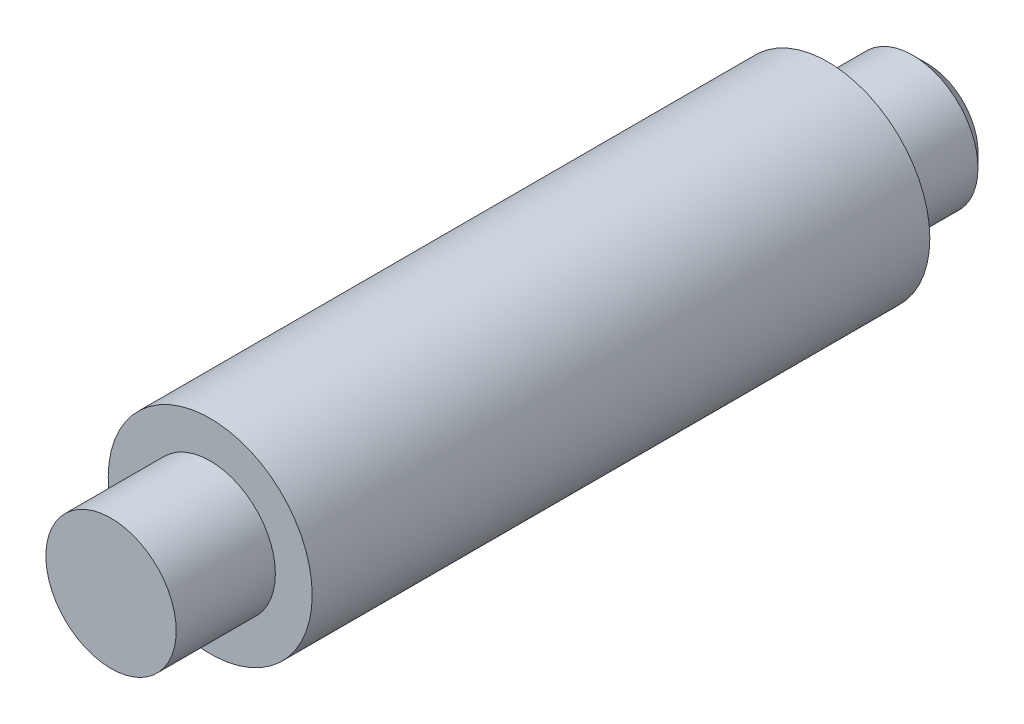
from build123d import *

# Parameters (mm, degrees)
SKETCH3_R           = 3.6
BOSS_EXTRUDE1_DEPTH = 21.8
SKETCH4_R           = 2.3
BOSS_EXTRUDE2_DEPTH = 3.5
BOSS_EXTRUDE3_START = 3.5
SKETCH5_R           = 2.3
BOSS_EXTRUDE3_DEPTH = 3.5
CHAMFER1_SIZE       = 0.5


with BuildPart() as part:
    # Sketch3 → Boss-Extrude1 (new body)
    with BuildSketch(Plane.XY):
        Circle(SKETCH3_R)
    extrude(amount=BOSS_EXTRUDE1_DEPTH)

    # Sketch4 → Boss-Extrude2 (add)
    with BuildSketch(Plane.XY):
        Circle(SKETCH4_R)
    extrude(amount=-BOSS_EXTRUDE2_DEPTH)

    # Sketch5 → Boss-Extrude3 (add)
    with BuildSketch(Plane.XY.offset(21.8).offset(BOSS_EXTRUDE3_START)):
        Circle(SKETCH5_R)
    extrude(amount=-BOSS_EXTRUDE3_DEPTH)

    # Chamfer1
    chamfer1_edges = [part.edges().sort_by_distance(p)[0] for p in [
        (-2.3, 0, -3.5),
    ]]
    chamfer(chamfer1_edges, length=CHAMFER1_SIZE)


solid = part.part
